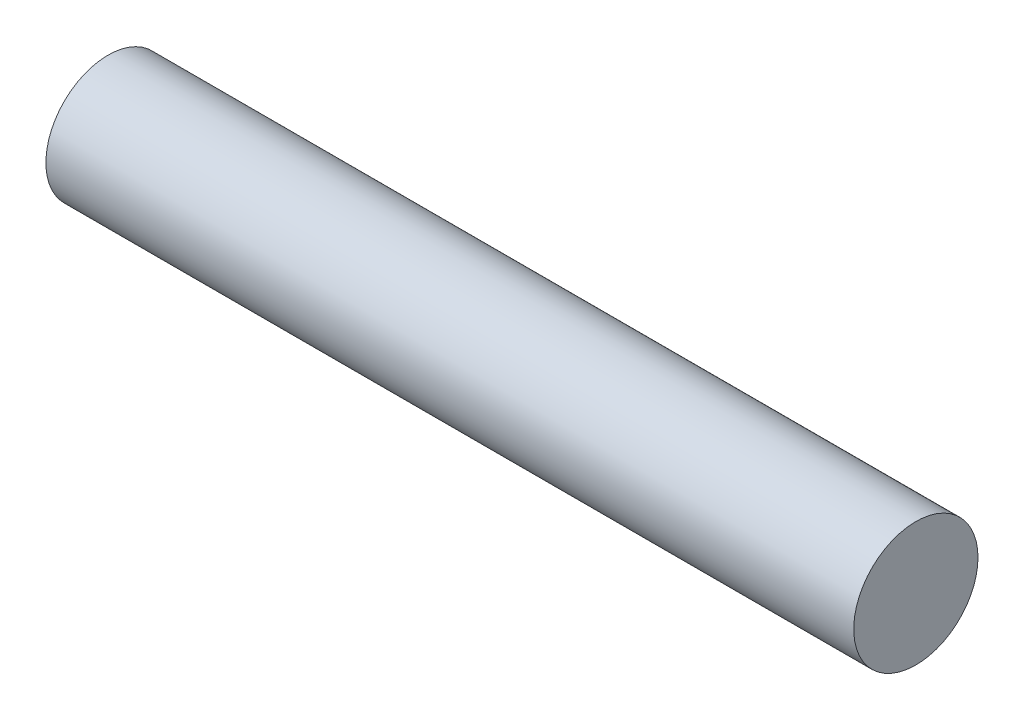
from build123d import *

# Parameters (mm, degrees)
SKETCH_1_R              = 2
F_01_SHAFT_D4_L26_DEPTH = 13


with BuildPart() as part:
    # 草图1 → 01_SHAFT_D4_L26 (new, symmetric)
    with BuildSketch(Plane(origin=(0, 0, 0), x_dir=(0, 0, -1), z_dir=(1, 0, 0))):
        Circle(SKETCH_1_R)
    extrude(amount=F_01_SHAFT_D4_L26_DEPTH, both=True)


solid = part.part
